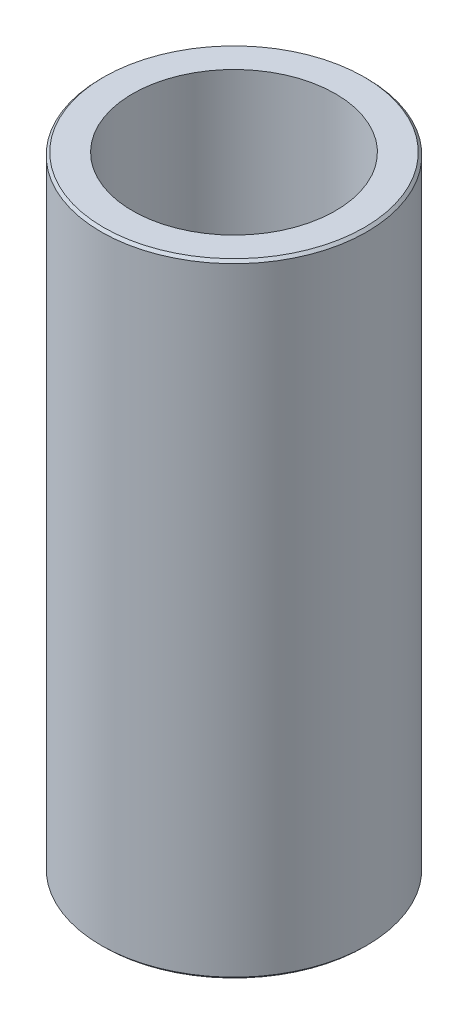
from build123d import *

# Parameters (mm, degrees)
SKETCH1_R           = 25
BOSS_EXTRUDE1_DEPTH = 117.230472299
SKETCH2_R           = 19.089806982
CUT_EXTRUDE1_DEPTH  = 123.4458396
CHAMFER1_SIZE       = 0.478419662


with BuildPart() as part:
    # Sketch1 → Boss-Extrude1 (new body)
    with BuildSketch(Plane(origin=(0, 0, 0), x_dir=(1, 0, 0), z_dir=(0, 1, 0))):
        Circle(SKETCH1_R)
    extrude(amount=BOSS_EXTRUDE1_DEPTH)

    # Sketch2 → Cut-Extrude1 (cut, through all)
    with BuildSketch(Plane(origin=(0, 0, 0), x_dir=(1, 0, 0), z_dir=(0, 1, 0))):
        Circle(SKETCH2_R)
    extrude(amount=CUT_EXTRUDE1_DEPTH, mode=Mode.SUBTRACT)

    # Chamfer1
    chamfer1_edges = [part.edges().sort_by_distance(p)[0] for p in [
        (-25, 117.230472299, 0),
        (-25, 0, 0),
    ]]
    chamfer(chamfer1_edges, length=CHAMFER1_SIZE)


solid = part.part
